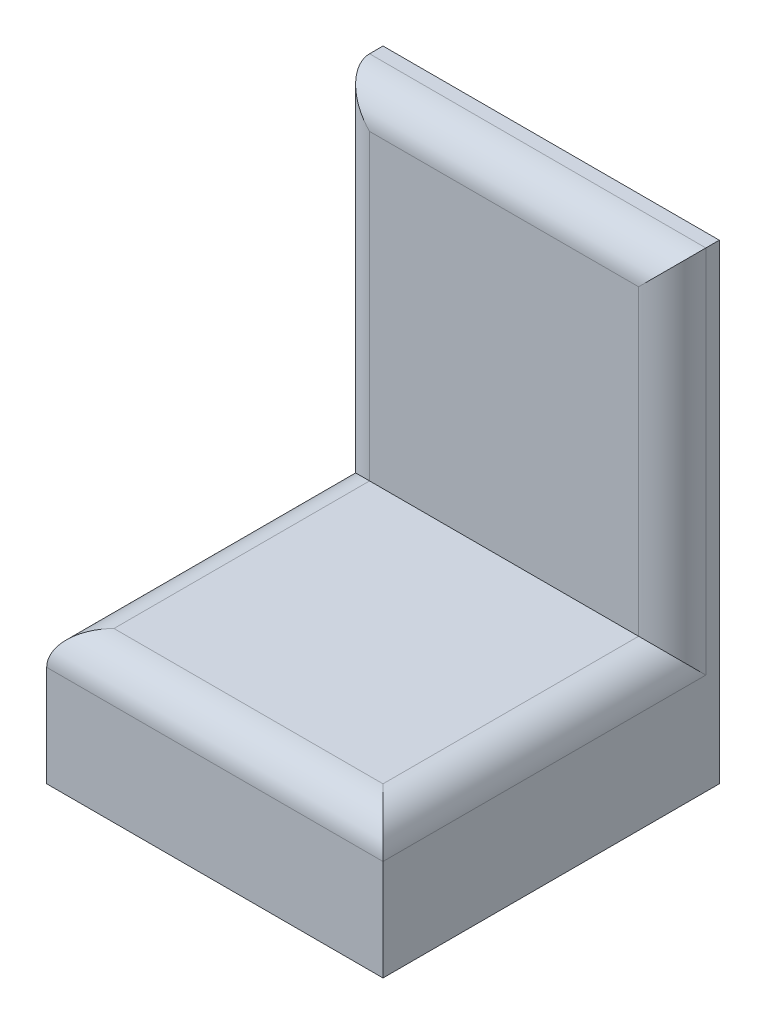
from build123d import *

# Parameters (mm, degrees)
BOSS_EXTRUDE1_DEPTH = 500
FILLET1_R           = 50
SHELL1_START        = 25.4
SHELL1_DEPTH        = 449.2
SHELL1_START_2      = 24
SHELL1_2_DEPTH      = 452
SHELL1_START_3      = 154
SHELL1_3_DEPTH      = 20.6
SHELL1_START_4      = 174.6
SHELL1_4_DEPTH      = 500.4


with BuildPart() as part:
    # Sketch1 → Boss-Extrude1 (new body)
    with BuildSketch(Plane(origin=(0, 0, 0), x_dir=(0, 0, -1), z_dir=(1, 0, 0))):
        Polygon((0, 0), (-500, 0), (-500, 200), (-70, 200), (-70, 700), (0, 700), (0, 41.235294118), align=None)
    extrude(amount=BOSS_EXTRUDE1_DEPTH)

    # Fillet1
    fillet1_edges = [part.edges().sort_by_distance(p)[0] for p in [
        (250, 200, 500),
        (250, 700, 70),
        (500, 450, 70),
        (500, 200, 285),
        (0, 200, 285),
        (0, 450, 70),
    ]]
    fillet(fillet1_edges, radius=FILLET1_R)

    # Shell1: read off the stored shape, not the designer's step
    # Shell1 outline → Shell1 (cut)
    with BuildSketch(Plane.YZ.offset(SHELL1_START)):
        with BuildLine():
            Line((25.4, 25.4), (674, 25.4))
            ThreePointArc((674, 25.4), (665.36749817, 39.209372712), (650, 44.6))
            Line((650, 44.6), (174.6, 44.6))
            Line((174.6, 44.6), (174.6, 450))
            ThreePointArc((174.6, 450), (167.394826817, 467.394826817), (150, 474.6))
            Line((150, 474.6), (25.4, 474.6))
            Line((25.4, 474.6), (25.4, 25.4))
        make_face()
    extrude(amount=SHELL1_DEPTH, mode=Mode.SUBTRACT)

    # Shell1 2 outline → Shell1 2 (add)
    with BuildSketch(Plane.XY.offset(SHELL1_START_2)):
        with BuildLine():
            ThreePointArc((25.4, 150), (32.605173183, 167.394826817), (50, 174.6))
            Line((50, 174.6), (25.4, 174.6))
            Line((25.4, 174.6), (25.4, 150))
        make_face()
        with BuildLine():
            ThreePointArc((450, 174.6), (467.394826817, 167.394826817), (474.6, 150))
            Line((474.6, 150), (474.6, 174.6))
            Line((474.6, 174.6), (450, 174.6))
        make_face()
    extrude(amount=SHELL1_2_DEPTH)

    # Shell1 3 outline → Shell1 3 (cut)
    with BuildSketch(Plane(origin=(0, 0, 0), x_dir=(1, 0, 0), z_dir=(0, 1, 0)).offset(SHELL1_START_3)):
        with BuildLine():
            ThreePointArc((450, -44.6), (465.36749817, -39.209372712), (474, -25.4))
            Line((474, -25.4), (26, -25.4))
            ThreePointArc((26, -25.4), (34.63250183, -39.209372712), (50, -44.6))
            Line((50, -44.6), (450, -44.6))
        make_face()
    extrude(amount=SHELL1_3_DEPTH, mode=Mode.SUBTRACT)

    # Shell1 4 outline → Shell1 4 (add)
    with BuildSketch(Plane(origin=(0, 0, 0), x_dir=(1, 0, 0), z_dir=(0, 1, 0)).offset(SHELL1_START_4)):
        with BuildLine():
            Line((474.6, -25.4), (474, -25.4))
            ThreePointArc((474, -25.4), (465.36749817, -39.209372712), (450, -44.6))
            Line((450, -44.6), (474.6, -44.6))
            Line((474.6, -44.6), (474.6, -25.4))
        make_face()
        with BuildLine():
            ThreePointArc((50, -44.6), (34.63250183, -39.209372712), (26, -25.4))
            Line((26, -25.4), (25.4, -25.4))
            Line((25.4, -25.4), (25.4, -44.6))
            Line((25.4, -44.6), (50, -44.6))
        make_face()
    extrude(amount=SHELL1_4_DEPTH)


solid = part.part
